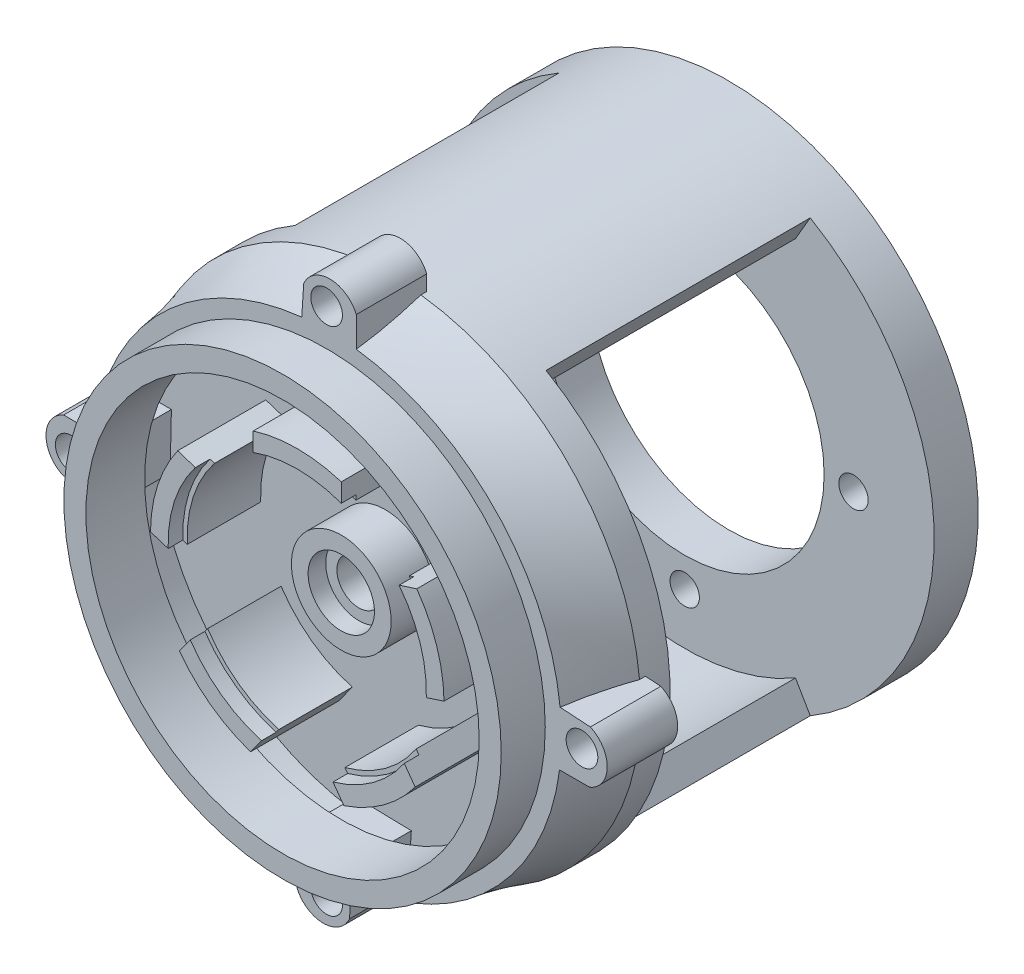
from build123d import *
from build123d.topology import SkipClean

# Parameters (mm, degrees)
SKETCH1_R           = 85
BOSS_EXTRUDE1_DEPTH = 10
SKETCH4_R           = 74.5
BOSS_EXTRUDE2_DEPTH = 15
SKETCH5_R           = 67
CUT_EXTRUDE1_DEPTH  = 20
SKETCH6_R           = 78
CUT_EXTRUDE2_DEPTH  = 15
BOSS_EXTRUDE3_DEPTH = 24
CIRPATTERN1_COUNT   = 4
CIRPATTERN2_COUNT   = 4
SKETCH14_R          = 17
BOSS_EXTRUDE4_DEPTH = 15
SKETCH15_R          = 11.3
CUT_EXTRUDE3_DEPTH  = 6
SKETCH16_R          = 7.5
CUT_EXTRUDE4_DEPTH  = 138.676917333
BOSS_EXTRUDE5_DEPTH = 30
BOSS_EXTRUDE6_START = 90
BOSS_EXTRUDE6_DEPTH = 90
BOSS_EXTRUDE7_START = 15
SKETCH19_R          = 85
BOSS_EXTRUDE7_DEPTH = 15
SKETCH20_R          = 47.5
CUT_EXTRUDE5_DEPTH  = 15
SKETCH21_R          = 5
CUT_EXTRUDE6_DEPTH  = 15
CIRPATTERN3_COUNT   = 4
SKETCH22_R          = 16.5
CUT_EXTRUDE7_DEPTH  = 9
FILLET1_R           = 5
SKETCH23_R          = 44
CUT_EXTRUDE8_DEPTH  = 5


with BuildPart() as part:
    # Sketch1 → Boss-Extrude1 (new body)
    with BuildSketch(Plane.XY):
        Circle(SKETCH1_R)
    extrude(amount=BOSS_EXTRUDE1_DEPTH)

    # Loft1: read off the stored shape, not the designer's step
    # Loft1: loft between two sections, ruled curve by curve
    loft1_from = [
        Edge.make_bspline([(-84.985889817, -1.548719476, 10), (-81.888450866, -171.52049911, 10), (88.083328768, -168.423060158, 10), (84.985889817, 1.548719476, 10), (81.888450866, 171.52049911, 10), (-88.083328768, 168.423060158, 10), (-84.985889817, -1.548719476, 10)], [0, 0, 0, 0, 0.5, 0.5, 0.5, 1, 1, 1, 1], 3, [1, 0.333333333, 0.333333333, 1, 0.333333333, 0.333333333, 1]),
    ]
    loft1_to = [
        Edge.make_bspline([(-77.561105187, -19.602932488, 32), (-38.35524021, -174.725142863, 32), (116.766970164, -135.519277886, 32), (77.561105187, 19.602932488, 32), (38.35524021, 174.725142863, 32), (-116.766970164, 135.519277886, 32), (-77.561105187, -19.602932488, 32)], [0, 0, 0, 0, 0.5, 0.5, 0.5, 1, 1, 1, 1], 3, [1, 0.333333333, 0.333333333, 1, 0.333333333, 0.333333333, 1]),
    ]
    loft1 = Solid(Shell([*[Face.make_surface_from_curves(loft1_from[k], loft1_to[k]) for k in range(1)], Face(Wire(loft1_from)), Face(Wire(loft1_to))]))
    add(loft1)

    # Sketch4 → Boss-Extrude2 (add)
    with BuildSketch(Plane.XY.offset(32)):
        Circle(SKETCH4_R)
    extrude(amount=BOSS_EXTRUDE2_DEPTH)

    # Sketch5 → Cut-Extrude1 (cut)
    with BuildSketch(Plane.XY.offset(47)):
        Circle(SKETCH5_R)
    extrude(amount=-CUT_EXTRUDE1_DEPTH, mode=Mode.SUBTRACT)

    # Sketch6 → Cut-Extrude2 (cut)
    with BuildSketch(Plane.XY.offset(27)):
        Circle(SKETCH6_R)
    extrude(amount=-CUT_EXTRUDE2_DEPTH, mode=Mode.SUBTRACT)

    # Sketch7 → Boss-Extrude3 (add)
    with BuildSketch(Plane.XY.offset(32)):
        with BuildLine():
            Line((10.112026185, 72.868932946), (10.112026185, 89.597937942))
            ThreePointArc((10.112026185, 89.597937942), (1.241313299, 95.599557722), (-7.797588157, 89.854364291))
            Line((-7.797588157, 89.854364291), (-8.860692334, 73.2984328))
            Line((-8.860692334, 73.2984328), (10.112026185, 72.868932946))
        make_face()
    boss_extrude3 = extrude(amount=-BOSS_EXTRUDE3_DEPTH)

    # CirPattern1: Boss-Extrude3 ×4 about axis
    cirpattern1_axis = Axis((0, 0, 0), (0, 0, 1))
    for i in range(1, CIRPATTERN1_COUNT):
        add(boss_extrude3.rotate(cirpattern1_axis, i * 360 / CIRPATTERN1_COUNT))

    # Sketch13 → M12x1.25 Tapped Hole1 (revolve, cut)
    with BuildSketch(Plane(origin=(0, 87, 32), x_dir=(0, -1, 0), z_dir=(1, 0, 0))):
        Polygon((0, 0), (0, 23.494647343), (5.4, 20.25), (5.4, 0), align=None)
    m12x1_25_tapped_hole1 = revolve(axis=Axis((0, 87, 38.35), (0, 0, -1)), mode=Mode.SUBTRACT)

    # CirPattern2: M12x1.25 Tapped Hole1 ×4 about axis
    cirpattern2_axis = Axis((0, 0, 0), (0, 0, 1))
    for i in range(1, CIRPATTERN2_COUNT):
        add(m12x1_25_tapped_hole1.rotate(cirpattern2_axis, i * 360 / CIRPATTERN2_COUNT), mode=Mode.SUBTRACT)

    # Sketch14 → Boss-Extrude4 (add)
    with BuildSketch(Plane.XY.offset(12)):
        Circle(SKETCH14_R)
    extrude(amount=BOSS_EXTRUDE4_DEPTH)

    # Sketch15 → Cut-Extrude3 (cut)
    with BuildSketch(Plane.XY.offset(27)):
        Circle(SKETCH15_R)
    extrude(amount=-CUT_EXTRUDE3_DEPTH, mode=Mode.SUBTRACT)

    # Sketch16 → Cut-Extrude4 (cut, through all)
    with BuildSketch(Plane.XY.offset(21)):
        Circle(SKETCH16_R)
    extrude(amount=-CUT_EXTRUDE4_DEPTH, mode=Mode.SUBTRACT)

    # Sketch17 → Boss-Extrude5 (add)
    with BuildSketch(Plane.XY.offset(12)):
        with BuildLine():
            Line((33.183444972, 26.553888224), (40.727249767, 29.005018986))
            ThreePointArc((40.727249767, 29.005018986), (47.552825815, 15.450849719), (49.997759598, 0.473323497))
            Line((49.997759598, 0.473323497), (42.453954803, -1.977807265))
            ThreePointArc((42.453954803, -1.977807265), (40.419901943, 13.133222261), (33.183444972, 26.553888224))
        make_face()
        with BuildLine():
            Line((15, 39.764934301), (15, 47.696960071))
            ThreePointArc((15, 47.696960071), (0, 50), (-15, 47.696960071))
            Line((-15, 47.696960071), (-15, 39.764934301))
            ThreePointArc((-15, 39.764934301), (0, 42.5), (15, 39.764934301))
        make_face()
        with BuildLine():
            Line((35.508496856, -23.353728846), (40.170824624, -29.770872493))
            ThreePointArc((40.170824624, -29.770872493), (29.389262615, -40.450849719), (15.900314793, -47.404430062))
            Line((15.900314793, -47.404430062), (11.237987025, -40.987286414))
            ThreePointArc((11.237987025, -40.987286414), (24.980873222, -34.383222261), (35.508496856, -23.353728846))
        make_face()
        with BuildLine():
            Line((-11.237987025, -40.987286414), (-15.900314793, -47.404430062))
            ThreePointArc((-15.900314793, -47.404430062), (-29.389262615, -40.450849719), (-40.170824624, -29.770872493))
            Line((-40.170824624, -29.770872493), (-35.508496856, -23.353728846))
            ThreePointArc((-35.508496856, -23.353728846), (-24.980873222, -34.383222261), (-11.237987025, -40.987286414))
        make_face()
        with BuildLine():
            Line((-42.453954803, -1.977807265), (-49.997759598, 0.473323497))
            ThreePointArc((-49.997759598, 0.473323497), (-47.552825815, 15.450849719), (-40.727249767, 29.005018986))
            Line((-40.727249767, 29.005018986), (-33.183444972, 26.553888224))
            ThreePointArc((-33.183444972, 26.553888224), (-40.419901943, 13.133222261), (-42.453954803, -1.977807265))
        make_face()
    extrude(amount=BOSS_EXTRUDE5_DEPTH)

    # Sketch18 → Boss-Extrude6 (add)
    with SkipClean():  # the faces are left unmerged after this step: merging them gives an invalid solid
        with BuildSketch(Plane(origin=(0, 0, 0), x_dir=(-1, 0, 0), z_dir=(0, 0, -1)).offset(BOSS_EXTRUDE6_START)):
            with BuildLine():
                Line((37.739875069, 64.812821492), (42.771858411, 73.454531025))
                ThreePointArc((42.771858411, 73.454531025), (0, 85), (-42.771858411, 73.454531025))
                Line((-42.771858411, 73.454531025), (-37.739875069, 64.812821492))
                ThreePointArc((-37.739875069, 64.812821492), (0, 75), (37.739875069, 64.812821492))
            make_face()
            with BuildLine():
                Line((37.739875069, -64.812821492), (42.771858411, -73.454531025))
                ThreePointArc((42.771858411, -73.454531025), (0, -85), (-42.771858411, -73.454531025))
                Line((-42.771858411, -73.454531025), (-37.739875069, -64.812821492))
                ThreePointArc((-37.739875069, -64.812821492), (0, -75), (37.739875069, -64.812821492))
            make_face()
        extrude(amount=-BOSS_EXTRUDE6_DEPTH)

    # Sketch19 → Boss-Extrude7 (add)
    with BuildSketch(Plane(origin=(0, 0, -90), x_dir=(-1, 0, 0), z_dir=(0, 0, -1)).offset(BOSS_EXTRUDE7_START)):
        Circle(SKETCH19_R)
    extrude(amount=-BOSS_EXTRUDE7_DEPTH)

    # Sketch20 → Cut-Extrude5 (cut)
    with BuildSketch(Plane(origin=(0, 0, -105), x_dir=(-1, 0, 0), z_dir=(0, 0, -1))):
        Circle(SKETCH20_R)
    extrude(amount=-CUT_EXTRUDE5_DEPTH, mode=Mode.SUBTRACT)

    # Sketch21 → Cut-Extrude6 (cut)
    with BuildSketch(Plane(origin=(0, 0, -105), x_dir=(-1, 0, 0), z_dir=(0, 0, -1))):
        with Locations((0, 57.5)):
            Circle(SKETCH21_R)
    cut_extrude6 = extrude(amount=-CUT_EXTRUDE6_DEPTH, mode=Mode.SUBTRACT)

    # CirPattern3: Cut-Extrude6 ×4 about axis
    cirpattern3_axis = Axis((0, 0, 0), (0, 0, 1))
    for i in range(1, CIRPATTERN3_COUNT):
        add(cut_extrude6.rotate(cirpattern3_axis, i * 360 / CIRPATTERN3_COUNT), mode=Mode.SUBTRACT)

    # Sketch22 → Cut-Extrude7 (cut)
    with BuildSketch(Plane(origin=(0, 0, 0), x_dir=(-1, 0, 0), z_dir=(0, 0, -1))):
        Circle(SKETCH22_R)
    extrude(amount=-CUT_EXTRUDE7_DEPTH, mode=Mode.SUBTRACT)

    # Fillet1
    fillet1_edges = [part.edges().sort_by_distance(p)[0] for p in [
        (16.5, 0, 9),
    ]]
    fillet(fillet1_edges, radius=FILLET1_R)

    # Sketch23 → Cut-Extrude8 (cut)
    with SkipClean():  # the faces are left unmerged after this step: merging them gives an invalid solid
        with BuildSketch(Plane.XY.offset(42)):
            Circle(SKETCH23_R)
        extrude(amount=-CUT_EXTRUDE8_DEPTH, mode=Mode.SUBTRACT)


solid = part.part
